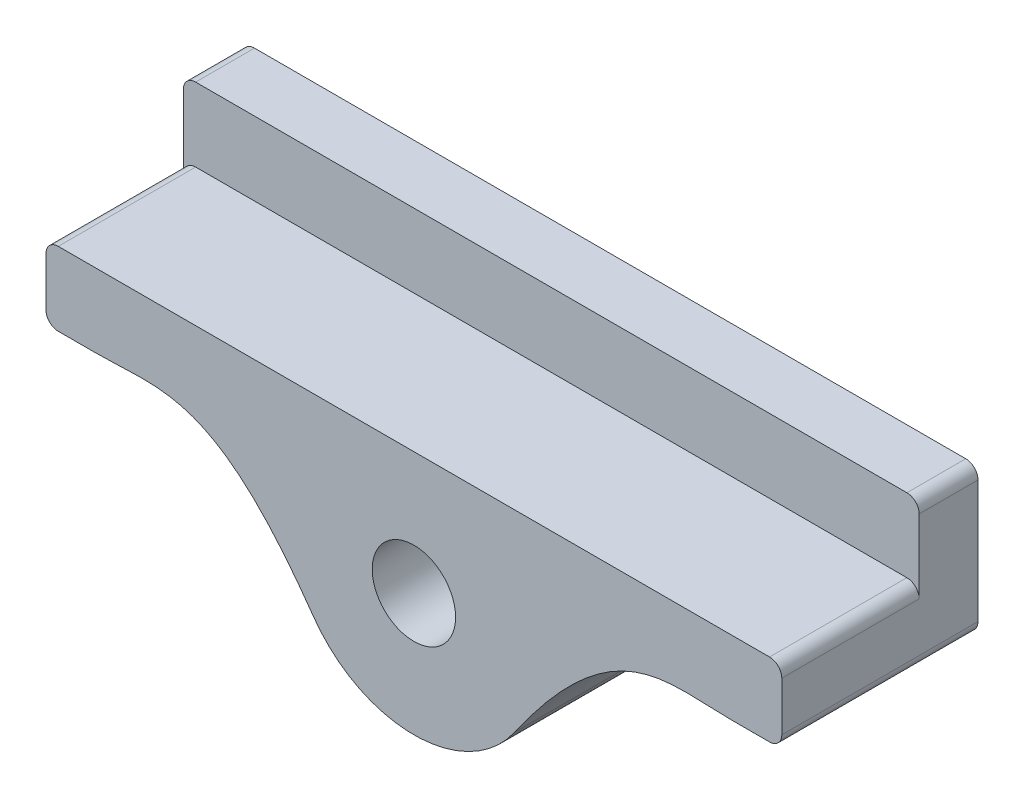
from build123d import *

# Parameters (mm, degrees)
SKETCH1_R           = 1.7
BOSS_EXTRUDE1_DEPTH = 8
SKETCH2_W           = 30
SKETCH2_H           = 3
CUT_EXTRUDE1_DEPTH  = 5.6
FILLET1_R           = 0.5
SKETCH5_R           = 3.7
CUT_EXTRUDE2_DEPTH  = 1
CHAMFER1_SIZE       = 2
SKETCH6_R           = 1.7
BOSS_EXTRUDE2_DEPTH = 0.4
BOSS_EXTRUDE3_START = -0.4
SKETCH7_R           = 3.7
BOSS_EXTRUDE3_DEPTH = 0.4


with BuildPart() as part:
    # Sketch1 → Boss-Extrude1 (new body)
    with BuildSketch(Plane.XY):
        with BuildLine():
            Line((20, 6), (20, 0))
            Line((20, 0), (18, 0))
            add(Edge.make_bspline(
                [(18, 0), (15.260318753, 0), (13.131354564, 0.908049894), (9.098678762, -4.863709553)],
                knots=[0, 0, 0, 0, 1, 1, 1, 1], degree=3))
            ThreePointArc((9.098678762, -4.863709553), (5, -7), (0.901321238, -4.863709553))
            add(Edge.make_bspline(
                [(-8, 0), (-5.260318753, 0), (-3.131354564, 0.908049894), (0.901321238, -4.863709553)],
                knots=[0, 0, 0, 0, 1, 1, 1, 1], degree=3))
            Line((-8, 0), (-10, 0))
            Line((-10, 0), (-10, 6))
            Line((-10, 6), (20, 6))
        make_face()
        with Locations((5, -2)):
            Circle(SKETCH1_R, mode=Mode.SUBTRACT)
    extrude(amount=BOSS_EXTRUDE1_DEPTH)

    # Sketch2 → Cut-Extrude1 (cut)
    with BuildSketch(Plane.XY.offset(8)):
        with Locations((5, 4.5)):
            Rectangle(SKETCH2_W, SKETCH2_H)
    extrude(amount=-CUT_EXTRUDE1_DEPTH, mode=Mode.SUBTRACT)

    # Fillet1
    fillet1_edges = [part.edges().sort_by_distance(p)[0] for p in [
        (20, 0, 4),
        (-10, 0, 4),
        (20, 6, 1.2),
        (-10, 6, 1.2),
        (20, 3, 5.2),
        (-10, 3, 5.2),
    ]]
    fillet(fillet1_edges, radius=FILLET1_R)

    # Sketch5 → Cut-Extrude2 (cut)
    with BuildSketch(Plane(origin=(0, 0, 0), x_dir=(-1, 0, 0), z_dir=(0, 0, -1))):
        with Locations((-5, -2)):
            Circle(SKETCH5_R)
    extrude(amount=-CUT_EXTRUDE2_DEPTH, mode=Mode.SUBTRACT)

    # Chamfer1
    chamfer1_edges = [part.edges().sort_by_distance(p)[0] for p in [
        (3.3, -2, 1),
    ]]
    chamfer(chamfer1_edges, length=CHAMFER1_SIZE - 0.0001)  # a hair under: the kernel refuses the full size

    # Sketch6 → Boss-Extrude2 (add)
    with BuildSketch(Plane.XY.offset(3)):
        with Locations((5, -2)):
            Circle(SKETCH6_R)
    extrude(amount=BOSS_EXTRUDE2_DEPTH)

    # Sketch7 → Boss-Extrude3 (add)
    with BuildSketch(Plane.XY.offset(1).offset(BOSS_EXTRUDE3_START)):
        with Locations(Location((5, -2, 0), (0, 0, 180))):
            Circle(SKETCH7_R)
    extrude(amount=BOSS_EXTRUDE3_DEPTH)


solid = part.part
